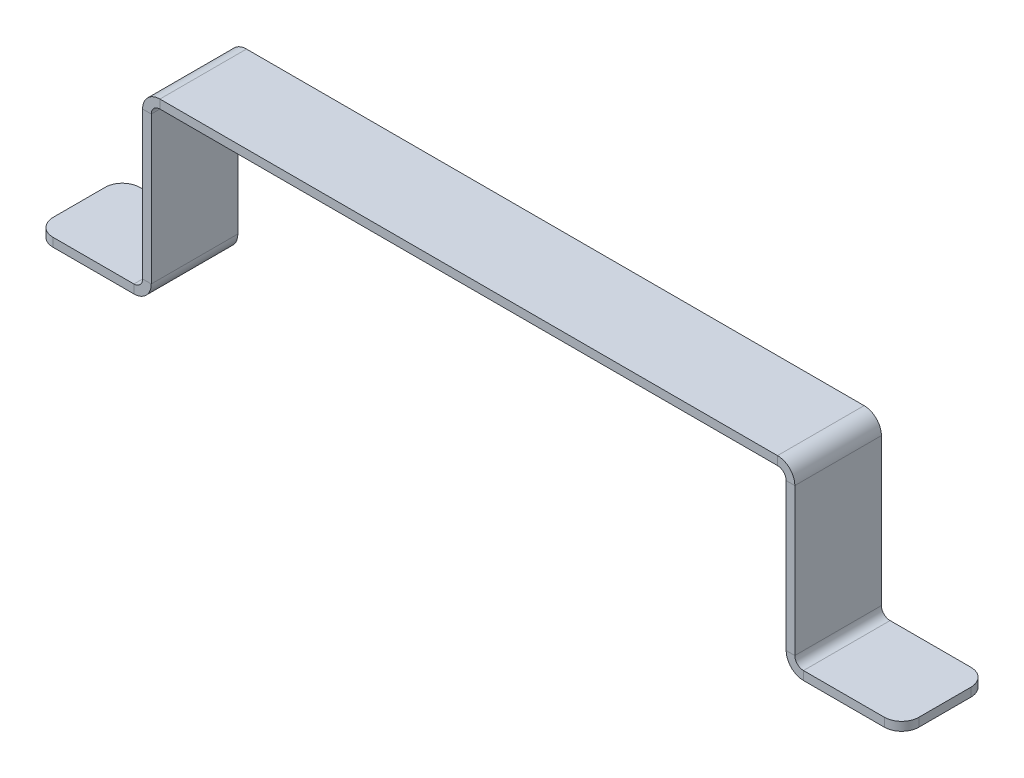
from build123d import *

# Parameters (mm, degrees)
BASE_FLANGE1_DEPTH = 7.5
FILLET1_R          = 3


# Sheet-metal steps are written as plain solids
with BuildPart() as part:
    # Sketch1 → Base-Flange1 (new, symmetric)
    with BuildSketch(Plane.XY):
        with BuildLine():
            Line((-75, 0), (-58, 0))
            ThreePointArc((-58, 0), (-55.878679656, 0.878679656), (-55, 3))
            Line((-55, 3), (-55, 28.5))
            ThreePointArc((-55, 28.5), (-54.560660172, 29.560660172), (-53.5, 30))
            Line((-53.5, 30), (53.5, 30))
            ThreePointArc((53.5, 30), (54.560660172, 29.560660172), (55, 28.5))
            Line((55, 28.5), (55, 3))
            ThreePointArc((55, 3), (55.878679656, 0.878679656), (58, 0))
            Line((58, 0), (75, 0))
            Line((75, 0), (75, 1.5))
            Line((75, 1.5), (58, 1.5))
            ThreePointArc((58, 1.5), (56.939339828, 1.939339828), (56.5, 3))
            Line((56.5, 3), (56.5, 28.5))
            ThreePointArc((56.5, 28.5), (55.621320344, 30.621320344), (53.5, 31.5))
            Line((53.5, 31.5), (-53.5, 31.5))
            ThreePointArc((-53.5, 31.5), (-55.621320344, 30.621320344), (-56.5, 28.5))
            Line((-56.5, 28.5), (-56.5, 3))
            ThreePointArc((-56.5, 3), (-56.939339828, 1.939339828), (-58, 1.5))
            Line((-58, 1.5), (-75, 1.5))
            Line((-75, 1.5), (-75, 0))
        make_face()
    extrude(amount=BASE_FLANGE1_DEPTH, both=True)

    # Fillet1
    fillet1_edges = [part.edges().sort_by_distance(p)[0] for p in [
        (75, 0.75, -7.5),
        (-75, 0.75, -7.5),
        (75, 0.75, 7.5),
        (-75, 0.75, 7.5),
    ]]
    fillet(fillet1_edges, radius=FILLET1_R)


solid = part.part
